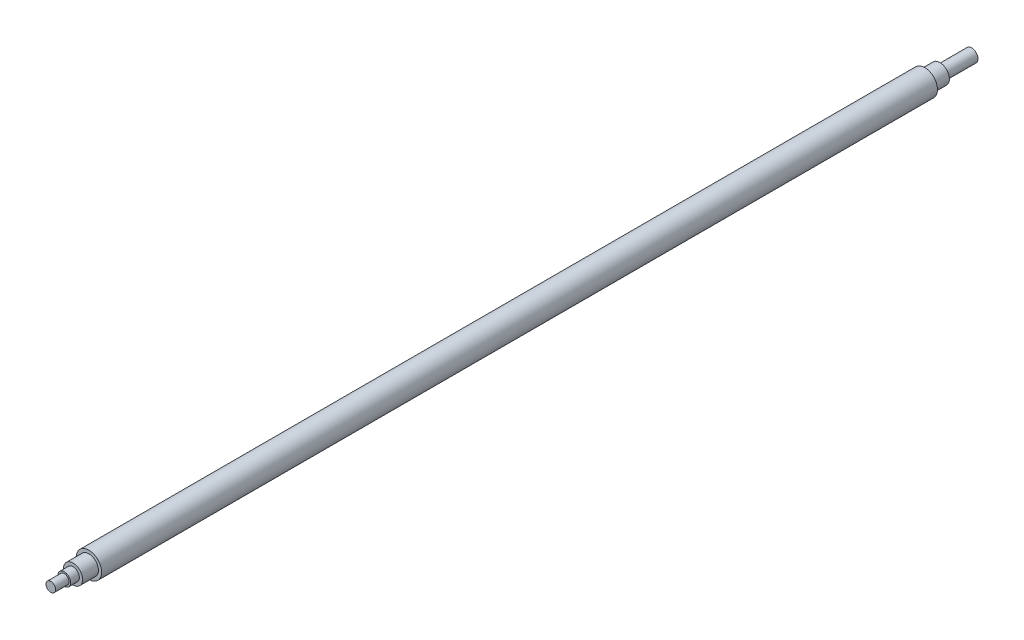
from build123d import *


with BuildPart() as part:
    # Schizzo2 → Rivoluzione2 (revolve)
    with BuildSketch(Plane(origin=(0, 0, 0), x_dir=(0, 0, -1), z_dir=(1, 0, 0))):
        Polygon((8.5, 0), (8.5, 3), (17, 3), (17, 4), (22.5, 4), (22.5, 6), (32.5, 6), (32.5, 8), (558.5, 8), (558.5, 6), (568, 6), (568, 4), (588, 4), (588, 0), align=None)
    revolve(axis=Axis((0, 0, 0), (0, 0, -1)))


solid = part.part
